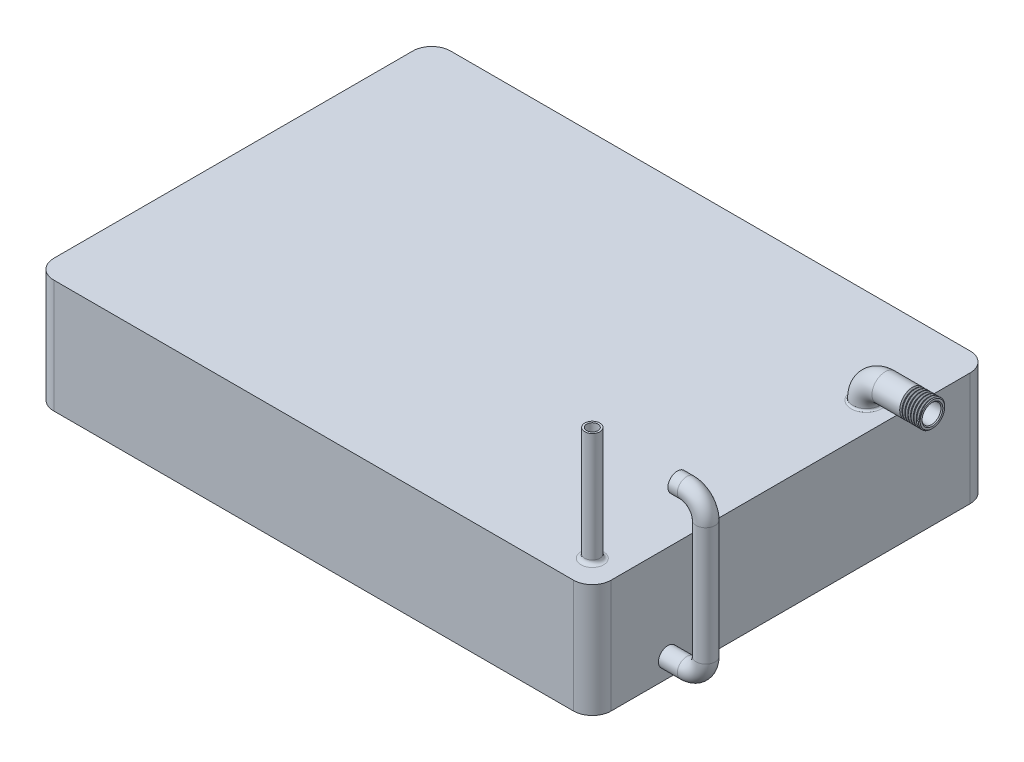
from build123d import *

# Parameters (mm, degrees)
BOSS_EXTRUDE1_DEPTH     = 60
CUT_EXTRUDE1_START      = -5
CUT_EXTRUDE1_DEPTH      = 50
CUT_EXTRUDE2_DEPTH      = 368.049043045
CUT_EXTRUDE2_DEPTH_BACK = 5
SKETCH4_R               = 3
SKETCH5_R               = 5
CUT_EXTRUDE3_DEPTH      = 10
SKETCH6_R               = 7
SKETCH6_R_2             = 5
BOSS_EXTRUDE2_START     = 60
SKETCH8_R               = 4
SKETCH8_R_2             = 3
BOSS_EXTRUDE2_DEPTH     = 60
FILLET2_R               = 2
SKETCH9_R               = 4
CUT_EXTRUDE4_DEPTH      = 5
SKETCH10_R              = 5
SKETCH10_R_2            = 4
FILLET3_R               = 1
THREAD1_PITCH           = 1.5
CHAMFER1_SIZE           = 0.5


# Some blends are built 0.0001 mm under size
with BuildPart() as part:
    # Sketch1 → Boss-Extrude1 (new body)
    with BuildSketch(Plane(origin=(0, 0, 0), x_dir=(1, 0, 0), z_dir=(0, 1, 0))):
        with BuildLine():
            Line((10, 0), (285, 0))
            ThreePointArc((285, 0), (292.071067812, 2.928932188), (295, 10))
            Line((295, 10), (295, 200))
            ThreePointArc((295, 200), (292.071067812, 207.071067812), (285, 210))
            Line((285, 210), (10, 210))
            ThreePointArc((10, 210), (2.928932188, 207.071067812), (0, 200))
            Line((0, 200), (0, 10))
            ThreePointArc((0, 10), (2.928932188, 2.928932188), (10, 0))
        make_face()
    extrude(amount=BOSS_EXTRUDE1_DEPTH)

    # Sketch3 → Cut-Extrude1 (cut)
    with BuildSketch(Plane(origin=(0, 60, 0), x_dir=(1, 0, 0), z_dir=(0, 1, 0)).offset(CUT_EXTRUDE1_START)):
        with BuildLine():
            Line((10, 5), (285, 5))
            ThreePointArc((285, 5), (288.535533906, 6.464466094), (290, 10))
            Line((290, 10), (290, 200))
            ThreePointArc((290, 200), (288.535533906, 203.535533906), (285, 205))
            Line((285, 205), (10, 205))
            ThreePointArc((10, 205), (6.464466094, 203.535533906), (5, 200))
            Line((5, 200), (5, 10))
            ThreePointArc((5, 10), (6.464466094, 6.464466094), (10, 5))
        make_face()
    extrude(amount=-CUT_EXTRUDE1_DEPTH, mode=Mode.SUBTRACT)

    # Sketch4 → Cut-Extrude2 (cut, two sides: drawn at the far end of the back side and taken through both)
    with BuildSketch(Plane(origin=(0, 60, 0), x_dir=(1, 0, 0), z_dir=(0, 1, 0)).offset(-CUT_EXTRUDE2_DEPTH_BACK)):
        with Locations(Location((280, 15, 0), (0, 0, 90))):
            Circle(SKETCH4_R)
    extrude(amount=CUT_EXTRUDE2_DEPTH + CUT_EXTRUDE2_DEPTH_BACK, mode=Mode.SUBTRACT)

    # Sketch5 → Cut-Extrude3 (cut)
    with BuildSketch(Plane(origin=(0, 60, 0), x_dir=(1, 0, 0), z_dir=(0, 1, 0))):
        with Locations(Location((280, 160, 0), (0, 0, 270))):
            Circle(SKETCH5_R)
    extrude(amount=-CUT_EXTRUDE3_DEPTH, mode=Mode.SUBTRACT)

    # Sweep6: sweep along a path in Sketch7
    with BuildLine(Plane(origin=(0, 0, -195), x_dir=(-1, 0, 0), z_dir=(0, 0, -1))) as sweep6_path:
        Line((-280, 60), (-280, 61))
        ThreePointArc((-280, 61), (-282.928932188, 68.071067812), (-290, 71))
        Line((-290, 71), (-315, 71))
    # Sketch6 → Sweep6 (sweep)
    with BuildSketch(Plane(origin=(0, 60, 0), x_dir=(1, 0, 0), z_dir=(0, 1, 0))):
        with Locations((280, 160)):
            Circle(SKETCH6_R)
        with Locations((280, 160)):
            Circle(SKETCH6_R_2, mode=Mode.SUBTRACT)
    sweep(path=sweep6_path.line)

    # Sketch8 → Boss-Extrude2 (add)
    with BuildSketch(Plane(origin=(0, 60, 0), x_dir=(1, 0, 0), z_dir=(0, 1, 0)).offset(BOSS_EXTRUDE2_START)):
        with Locations(Location((280, 15, 0), (0, 0, 90))):
            Circle(SKETCH8_R)
        with Locations(Location((280, 15, 0), (0, 0, 90))):
            Circle(SKETCH8_R_2, mode=Mode.SUBTRACT)
    extrude(amount=-BOSS_EXTRUDE2_DEPTH)

    # Fillet2
    fillet2_edges = [part.edges().sort_by_distance(p)[0] for p in [
        (280, 60, -11),
    ]]
    fillet(fillet2_edges, radius=FILLET2_R)

    # Sketch9 → Cut-Extrude4 (cut)
    with BuildSketch(Plane(origin=(295, 0, 0), x_dir=(0, 0, -1), z_dir=(1, 0, 0))):
        with Locations((40, 10)):
            Circle(SKETCH9_R)
    extrude(amount=-CUT_EXTRUDE4_DEPTH, mode=Mode.SUBTRACT)

    # Sweep7: sweep along a path in Sketch11
    with BuildLine(Plane.XY.offset(-40)) as sweep7_path:
        Line((295, 10), (305, 10))
        ThreePointArc((305, 10), (312.071067812, 12.928932188), (315, 20))
        Line((315, 20), (315, 82.5))
        ThreePointArc((315, 82.5), (312.071067812, 89.571067812), (305, 92.5))
        Line((305, 92.5), (300, 92.5))
    # Sketch10 → Sweep7 (sweep)
    with BuildSketch(Plane(origin=(295, 0, 0), x_dir=(0, 0, -1), z_dir=(1, 0, 0))):
        with Locations((40, 10)):
            Circle(SKETCH10_R)
        with Locations((40, 10)):
            Circle(SKETCH10_R_2, mode=Mode.SUBTRACT)
    sweep(path=sweep7_path.line)

    # Fillet3
    fillet3_edges = [part.edges().sort_by_distance(p)[0] for p in [
        (273, 60, -160),
    ]]
    fillet(fillet3_edges, radius=FILLET3_R - 0.0001)  # a hair under: the kernel refuses the full size

    # Thread1: the profile of Thread Profile1 profile screwed along a right-hand helix of 6.666667 turns, 8 arcs to a turn; built about Z, then put on its axis
    thread1_z = Axis((0, 0, 0), (0, 0, 1))
    thread1_corners = [(7.0003, 0, -0.000173205), (7.0003, 0, 1.312673201), (6.188101187, 0, 0.843749998), (6.188101187, 0, 0.468749998)]
    with BuildLine(mode=Mode.PRIVATE) as thread1_profile:
        Line(thread1_corners[0], thread1_corners[1])
        Line(thread1_corners[1], thread1_corners[2])
        Line(thread1_corners[2], thread1_corners[3])
        Line(thread1_corners[3], thread1_corners[0])
    thread1_cap = Face(thread1_profile.wire())
    thread1_turn_angles = [0, 22.5, 45, 67.5, 90, 112.5, 135, 157.5, 180, 202.5, 225, 247.5, 270, 292.5, 315, 337.5, 360]
    thread1_turn_weights = [1, 0.9238795325112867, 1, 0.9238795325112867, 1, 0.9238795325112867, 1, 0.9238795325112867, 1, 0.9238795325112867, 1, 0.9238795325112867, 1, 0.9238795325112867, 1, 0.9238795325112867, 1]
    thread1_turn_rails = [Edge.make_bspline([Vector(p[0], p[1], 0).rotate(thread1_z, thread1_turn_angles[k]) / thread1_turn_weights[k] + Vector(0, 0, p[2] + THREAD1_PITCH * thread1_turn_angles[k] / 360) for k in range(17)], [0, 0, 0, 1, 1, 2, 2, 3, 3, 4, 4, 5, 5, 6, 6, 7, 7, 8, 8, 8], 2, thread1_turn_weights) for p in thread1_corners]
    thread1_turn_sides = [Face.make_surface_from_curves(thread1_turn_rails[p[0]], thread1_turn_rails[p[1]]) for p in [(0, 1), (1, 2), (2, 3), (3, 0)]]
    thread1_last_angles = [2160, 2182.5, 2205, 2227.5, 2250, 2272.5, 2295, 2317.5, 2340, 2362.5, 2385, 2392.5, 2400]
    thread1_last_weights = [1, 0.9238795325112867, 1, 0.9238795325112867, 1, 0.9238795325112867, 1, 0.9238795325112867, 1, 0.9238795325112867, 1, 0.9914448613738109, 1]
    thread1_last_rails = [Edge.make_bspline([Vector(p[0], p[1], 0).rotate(thread1_z, thread1_last_angles[k]) / thread1_last_weights[k] + Vector(0, 0, p[2] + THREAD1_PITCH * thread1_last_angles[k] / 360) for k in range(13)], [0, 0, 0, 1, 1, 2, 2, 3, 3, 4, 4, 5, 5, 6, 6, 6], 2, thread1_last_weights) for p in thread1_corners]
    thread1_last_sides = [Face.make_surface_from_curves(thread1_last_rails[p[0]], thread1_last_rails[p[1]]) for p in [(0, 1), (1, 2), (2, 3), (3, 0)]]
    thread1 = Plane(origin=(315, 71, -160), x_dir=(0, 0, 1), z_dir=(-1, 0, 0)) * Solid(Shell([*[p.moved(Location((0, 0, THREAD1_PITCH * i))) for i in range(6) for p in thread1_turn_sides], *thread1_last_sides, thread1_cap, thread1_cap.rotate(thread1_z, 2400).moved(Location((0, 0, THREAD1_PITCH * 2400 / 360)))]))
    add(thread1, mode=Mode.SUBTRACT)

    # Chamfer1
    # the kernel refuses this chamfer: 0.5 mm, written as the material it takes off along each edge
    with BuildSketch(Plane(origin=(315, 71, -160), x_dir=(0, 0, 1), z_dir=(0, 1, 0))) as chamfer1_piece_1:
        Polygon((7, -CHAMFER1_SIZE), (7 - CHAMFER1_SIZE, 0), (7, 0), align=None)
    revolve(axis=Axis((315, 71, -160), (1, 0, 0)), revolution_arc=90, mode=Mode.SUBTRACT)
    with BuildSketch(Plane(origin=(315, 71, -160), x_dir=(0, -1, 0), z_dir=(0, 0, 1))) as chamfer1_piece_2:
        Polygon((5, -CHAMFER1_SIZE), (5 + CHAMFER1_SIZE, 0), (5, 0), align=None)
    revolve(axis=Axis((315, 71, -160), (1, 0, 0)), mode=Mode.SUBTRACT)
    with BuildSketch(Plane(origin=(315, 71, -160), x_dir=(0, -1, 0), z_dir=(0, 0, 1))) as chamfer1_piece_3:
        Polygon((7 - CHAMFER1_SIZE, 0), (7, -CHAMFER1_SIZE), (7, 0), align=None)
    revolve(axis=Axis((315, 71, -160), (1, 0, 0)), revolution_arc=270, mode=Mode.SUBTRACT)


solid = part.part
